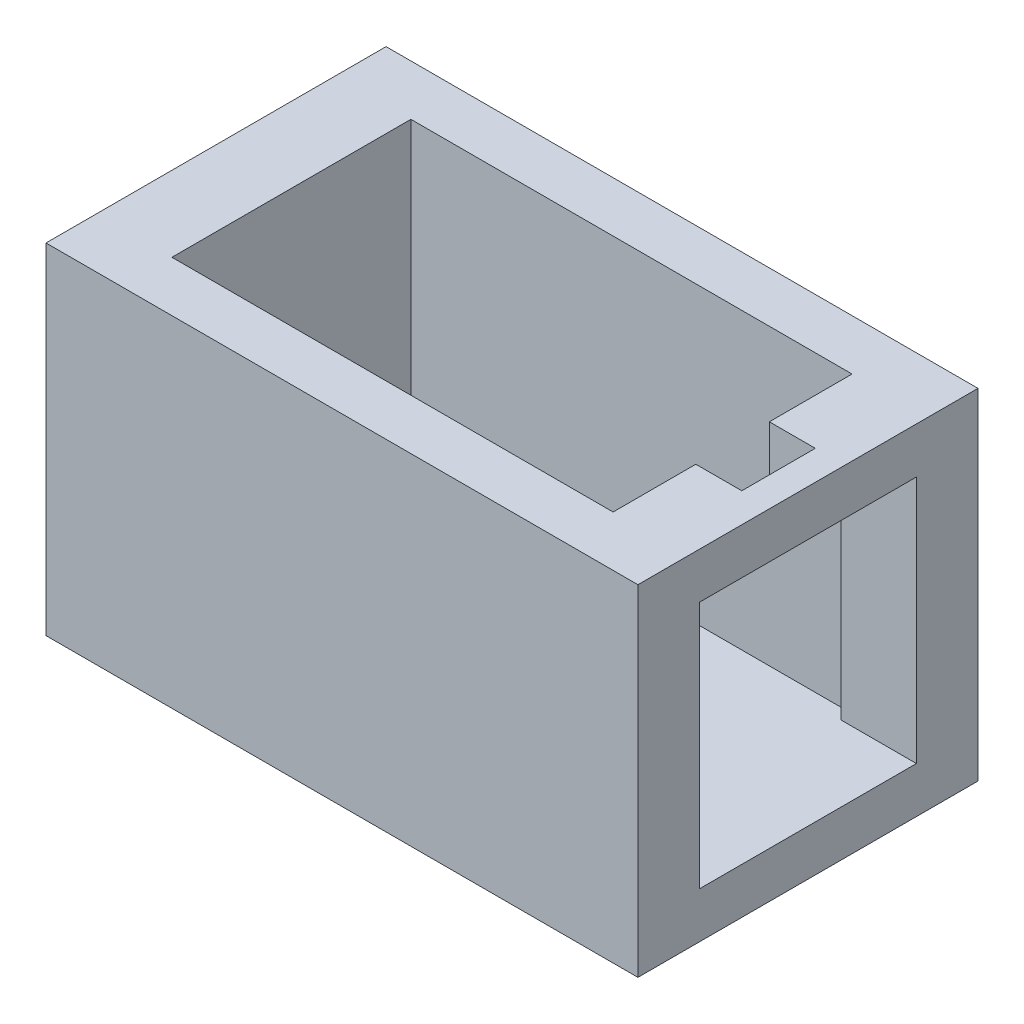
from build123d import *

# Parameters (mm, degrees)
SKETCH2_W           = 32.2
SKETCH2_H           = 18.5
BOSS_EXTRUDE1_DEPTH = 18.5
SKETCH3_W           = 24
SKETCH3_H           = 13
CUT_EXTRUDE1_DEPTH  = 16
SKETCH4_W           = 11.8
SKETCH4_H           = 13.5
CUT_EXTRUDE2_DEPTH  = 5
SKETCH5_W           = 2.5
SKETCH5_H           = 4
CUT_EXTRUDE3_DEPTH  = 2.5
SKETCH7_R           = 3.5
BOSS_EXTRUDE2_DEPTH = 5


with BuildPart() as part:
    # Sketch2 → Boss-Extrude1 (new body)
    with BuildSketch(Plane(origin=(0, 0, 0), x_dir=(1, 0, 0), z_dir=(0, 1, 0))):
        Rectangle(SKETCH2_W, SKETCH2_H)
    extrude(amount=-BOSS_EXTRUDE1_DEPTH)

    # Sketch3 → Cut-Extrude1 (cut)
    with BuildSketch(Plane(origin=(0, 0, 0), x_dir=(1, 0, 0), z_dir=(0, 1, 0))):
        Rectangle(SKETCH3_W, SKETCH3_H)
    extrude(amount=-CUT_EXTRUDE1_DEPTH, mode=Mode.SUBTRACT)

    # Sketch4 → Cut-Extrude2 (cut)
    with BuildSketch(Plane(origin=(16.1, 0, 0), x_dir=(0, 0, -1), z_dir=(1, 0, 0))):
        with Locations((0, -9.25)):
            Rectangle(SKETCH4_W, SKETCH4_H)
    extrude(amount=-CUT_EXTRUDE2_DEPTH, mode=Mode.SUBTRACT)

    # Sketch5 → Cut-Extrude3 (cut)
    with BuildSketch(Plane(origin=(0, 0, 0), x_dir=(1, 0, 0), z_dir=(0, 1, 0))):
        with Locations((13.25, 0)):
            Rectangle(SKETCH5_W, SKETCH5_H)
    extrude(amount=-CUT_EXTRUDE3_DEPTH, mode=Mode.SUBTRACT)

    # Sketch7 → Boss-Extrude2 (add)
    with BuildSketch(Plane.XZ.offset(18.5)):
        with Locations((6.1, -0.85)):
            Circle(SKETCH7_R)
    extrude(amount=BOSS_EXTRUDE2_DEPTH)


solid = part.part
